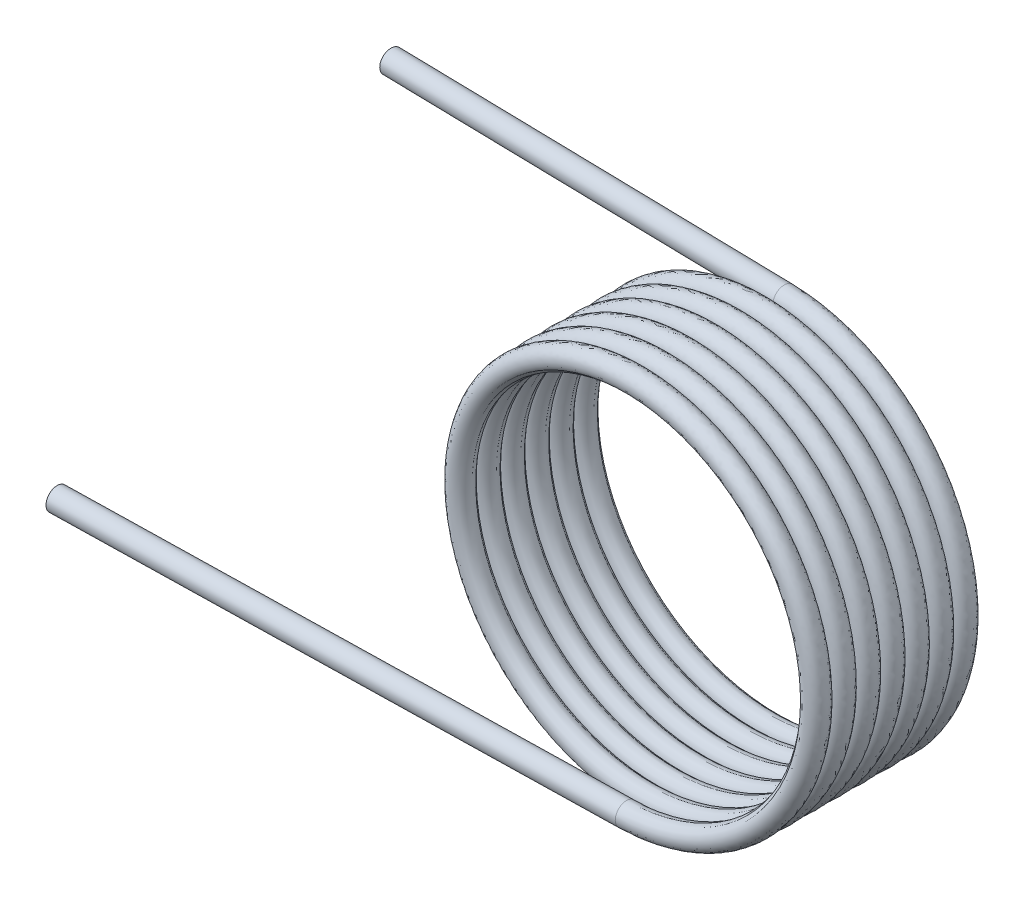
from build123d import *

# Parameters (mm, degrees)
SWEEP1_PITCH        = 3.126153846
SWEEP1_HEIGHT       = 20.32
SWEEP1_RADIUS       = 23.60295
SWEEP1_START_ANGLE  = 90
SKETCH2_R           = 1.4351
SKETCH3_R           = 1.4351
BOSS_EXTRUDE1_DEPTH = 101.6
SKETCH4_R           = 1.4351
BOSS_EXTRUDE2_DEPTH = 101.6
SKETCH5_R           = 5.71457576
CUT_EXTRUDE1_DEPTH  = 50
SKETCH6_R           = 6.6278677
CUT_EXTRUDE2_DEPTH  = 30


with BuildPart() as part:
    # Sweep1: sweep along a helix
    with BuildLine() as sweep1_path:
        add(Helix(SWEEP1_PITCH, SWEEP1_HEIGHT, SWEEP1_RADIUS, center=(0, 0, 0), direction=(0, 0, 1), lefthand=True, mode=Mode.PRIVATE).rotate(Axis((0, 0, 0), (0, 0, 1)), SWEEP1_START_ANGLE))
    # Sketch2 → Sweep1 (sweep)
    with BuildSketch(Plane(origin=(0, -23.60295, 20.32), x_dir=(0.02107500680690213, -2.8515923258819254e-15, 0.9997778973792575), z_dir=(-0.9997778973792575, 8.282579636549554e-14, 0.02107500680690213))):
        Circle(SKETCH2_R)
    sweep(path=sweep1_path.line, is_frenet=True)

    # Sketch3 → Boss-Extrude1 (add)
    with BuildSketch(Plane(origin=(0, 0, 0), x_dir=(-0.021075006806902132, 0, 0.9997778973792575), z_dir=(-0.9997778973792575, -4.380828031761045e-15, -0.021075006806902132))):
        with Locations((0, 23.60295)):
            Circle(SKETCH3_R)
    extrude(amount=BOSS_EXTRUDE1_DEPTH)

    # Sketch4 → Boss-Extrude2 (add)
    with BuildSketch(Plane(origin=(-0.428149024, 0, 0.009025248), x_dir=(0.021075006806902146, 7.590996781535367e-15, 0.9997778973792575), z_dir=(-0.9997778973792575, -4.488057786738959e-15, 0.021075006806902146))):
        with Locations((20.315486875, -23.60295)):
            Circle(SKETCH4_R)
    extrude(amount=BOSS_EXTRUDE2_DEPTH)

    # Sketch5 → Cut-Extrude1 (cut)
    with BuildSketch(Plane(origin=(-101.577434374, 0, -2.141220692), x_dir=(-0.021075006806902132, 0, 0.9997778973792575), z_dir=(-0.9997778973792575, -4.3808280317610446e-15, -0.021075006806902132))):
        with Locations((0, 23.60295)):
            Circle(SKETCH5_R)
    extrude(amount=-CUT_EXTRUDE1_DEPTH, mode=Mode.SUBTRACT)

    # Sketch6 → Cut-Extrude2 (cut)
    with BuildSketch(Plane(origin=(-102.005583398, 0, 2.15024594), x_dir=(0.02107500680690215, 0, 0.9997778973792576), z_dir=(-0.9997778973792576, -4.488057786738958e-15, 0.02107500680690215))):
        with Locations((20.315486875, -23.60295)):
            Circle(SKETCH6_R)
    extrude(amount=-CUT_EXTRUDE2_DEPTH, mode=Mode.SUBTRACT)


solid = part.part
